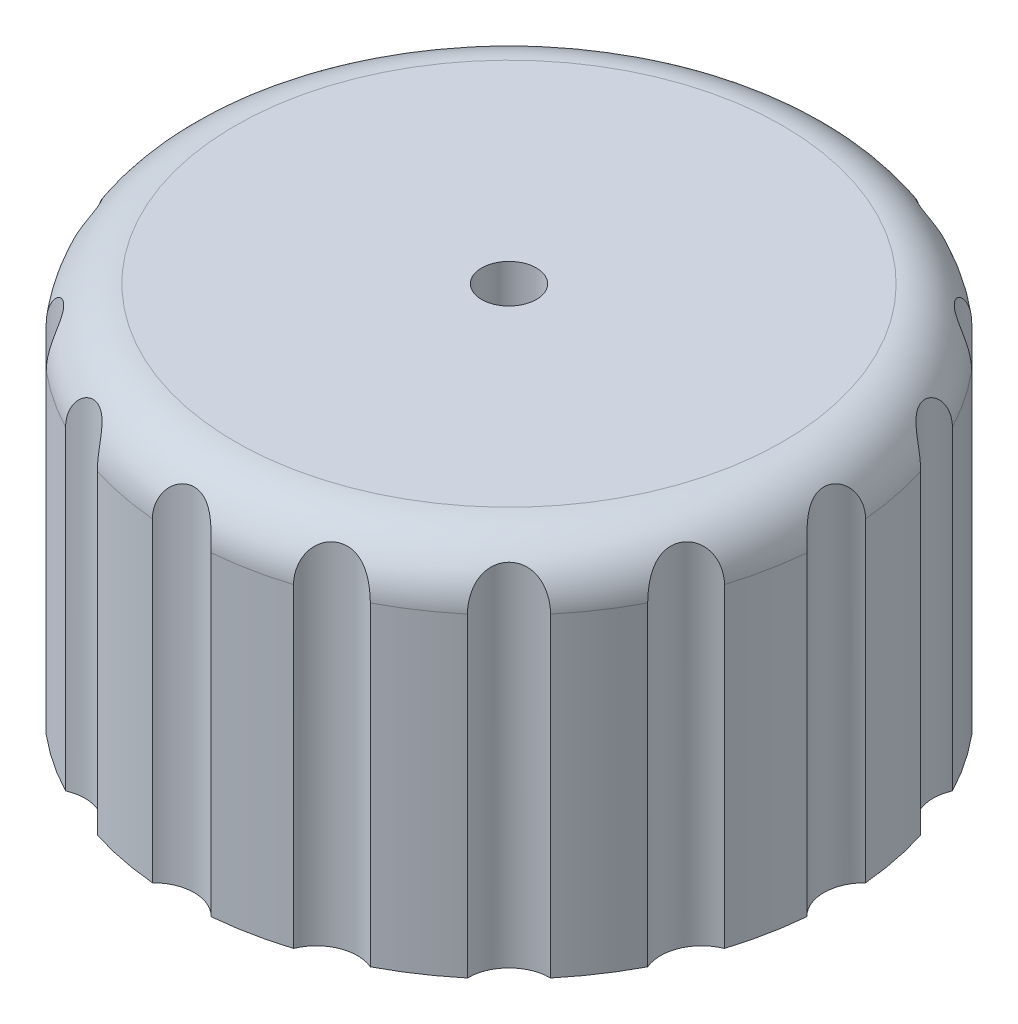
from build123d import *

# Parameters (mm, degrees)
FILLET1_R          = 1
SKETCH2_R          = 0.75
CUT_EXTRUDE1_DEPTH = 12.661903841
CIRPATTERN1_COUNT  = 16
SKETCH3_R          = 0.5
CUT_EXTRUDE2_DEPTH = 12.637191955


with BuildPart() as part:
    # Sketch1 → Revolve1 (revolve)
    with BuildSketch(Plane.XY):
        Polygon((-2.765, 0), (-2.765, 2.891054023), (0, 2.891054023), (0, 8), (-6, 8), (-6, 1.24483654), (-4.003398957, 1.24483654), (-3.067620744, 0), align=None)
    revolve(axis=Axis((0, 2.891054023, 0), (0, 1, 0)))

    # Fillet1
    fillet1_edges = [part.edges().sort_by_distance(p)[0] for p in [
        (6, 8, 0),
    ]]
    fillet(fillet1_edges, radius=FILLET1_R)

    # Sketch2 → Cut-Extrude1 (cut, through all)
    with BuildSketch(Plane(origin=(0, 0, 0), x_dir=(1, 0, 0), z_dir=(0, 1, 0))):
        with Locations((0, 6.5)):
            Circle(SKETCH2_R)
    cut_extrude1 = extrude(amount=CUT_EXTRUDE1_DEPTH, mode=Mode.SUBTRACT)

    # CirPattern1: Cut-Extrude1 ×16 about axis
    cirpattern1_axis = Axis((0, 8, 0), (0, 1, 0))
    for i in range(1, CIRPATTERN1_COUNT):
        add(cut_extrude1.rotate(cirpattern1_axis, i * 360 / CIRPATTERN1_COUNT), mode=Mode.SUBTRACT)

    # Sketch3 → Cut-Extrude2 (cut, through all)
    with BuildSketch(Plane(origin=(0, 0, 0), x_dir=(1, 0, 0), z_dir=(0, 1, 0))):
        Circle(SKETCH3_R)
    extrude(amount=CUT_EXTRUDE2_DEPTH, mode=Mode.SUBTRACT)


solid = part.part
